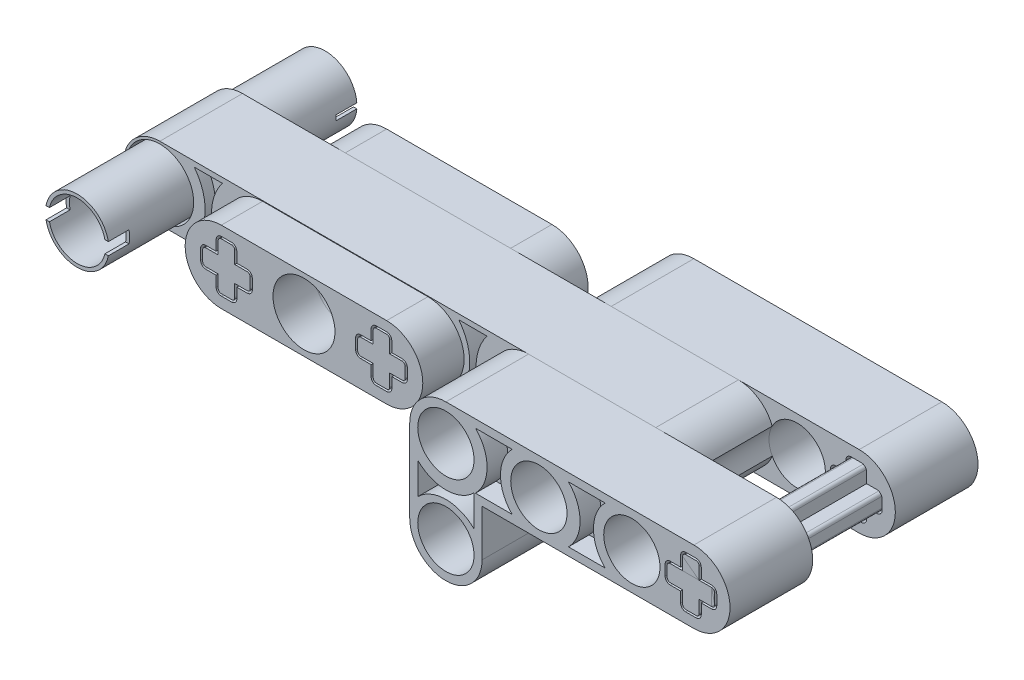
from build123d import *

# Parameters (mm, degrees)
BOSS_EXTRUDE2_DEPTH      = 8
CUT_EXTRUDE2_DEPTH       = 1
BOSS_EXTRUDE3_DEPTH      = 4
CUT_EXTRUDE3_START       = -1
CUT_EXTRUDE3_DEPTH       = 1
BOSS_EXTRUDE5_DEPTH      = 4
CUT_EXTRUDE6_DEPTH       = 33.014120225
SKETCH13_R               = 3.275
SKETCH13_R_2             = 3.075
CUT_EXTRUDE8_DEPTH       = 31.214299492
CUT_EXTRUDE9_DEPTH       = 33.014120225
SKETCH20_R               = 3
CUT_EXTRUDE10_DEPTH      = 33.014120225
BOSS_EXTRUDE6_DEPTH      = 8
BOSS_EXTRUDE6_DEPTH_BACK = 16
SKETCH21_R               = 3.075
SKETCH21_R_2             = 2.75
SKETCH22_W               = 6.441954092
SKETCH22_H               = 1.18479006
CUT_EXTRUDE11_DEPTH      = 2
SKETCH23_W               = 6.530888148
SKETCH23_H               = 0.5
CUT_EXTRUDE12_DEPTH      = 2
SKETCH24_R               = 2.75
CUT_EXTRUDE13_DEPTH      = 33.014120225
CUT_EXTRUDE14_DEPTH      = 2
BOSS_EXTRUDE8_DEPTH      = 8
BOSS_EXTRUDE10_DEPTH     = 8
CUT_EXTRUDE19_DEPTH      = 48.36948422
BOSS_EXTRUDE11_DEPTH     = 24
SKETCH42_R               = 2.725195378
CUT_EXTRUDE20_DEPTH      = 48.36948422
CUT_EXTRUDE21_DEPTH      = 2
CUT_EXTRUDE22_DEPTH      = 2
CUT_EXTRUDE23_DEPTH      = 2
CUT_EXTRUDE24_DEPTH      = 2
CUT_EXTRUDE25_DEPTH      = 2


with BuildPart() as part:
    # Sketch3 → Boss-Extrude2 (new body)
    with BuildSketch(Plane.XY):
        with BuildLine():
            Line((-24, 3.5), (24, 3.5))
            ThreePointArc((24, 3.5), (27.5, 0), (24, -3.5))
            Line((24, -3.5), (-24, -3.5))
            ThreePointArc((-24, -3.5), (-27.5, 0), (-24, 3.5))
        make_face()
    extrude(amount=BOSS_EXTRUDE2_DEPTH)

    # Sketch4 → Cut-Extrude2 (cut)
    with BuildSketch(Plane.XY.offset(8)):
        with BuildLine():
            Line((-20.670991697, 3), (-17.94298132, 3))
            ThreePointArc((-17.94298132, 3), (-19, -0.057231195), (-17.94298132, -3.114462389))
            Line((-17.94298132, -3.114462389), (-20.670991697, -3.114462389))
            ThreePointArc((-20.670991697, -3.114462389), (-19.613973017, -0.057231195), (-20.670991697, 3))
        make_face()
    extrude(amount=-CUT_EXTRUDE2_DEPTH, mode=Mode.SUBTRACT)

    # Sketch7 → Cut-Extrude3 (cut)
    with BuildSketch(Plane(origin=(0, 0, 0), x_dir=(-1, 0, 0), z_dir=(0, 0, -1)).offset(CUT_EXTRUDE3_START)):
        with BuildLine():
            Line((17.94298132, 3), (20.670991697, 3))
            ThreePointArc((20.670991697, 3), (19.613973017, -0.057231195), (20.670991697, -3.114462389))
            Line((20.670991697, -3.114462389), (17.94298132, -3.114462389))
            ThreePointArc((17.94298132, -3.114462389), (19, -0.057231195), (17.94298132, 3))
        make_face()
    extrude(amount=CUT_EXTRUDE3_DEPTH, mode=Mode.SUBTRACT)


with BuildPart() as body_2:
    # Sketch5 → Boss-Extrude3 (new body)
    with BuildSketch(Plane.XY.offset(8)):
        with BuildLine():
            Line((-14.050252532, 3.442768805), (1.949747468, 3.442768805))
            ThreePointArc((1.949747468, 3.442768805), (5.449747468, -0.057231195), (1.949747468, -3.557231195))
            Line((1.949747468, -3.557231195), (-14.050252532, -3.557231195))
            ThreePointArc((-14.050252532, -3.557231195), (-17.550252532, -0.057231195), (-14.050252532, 3.442768805))
        make_face()
    extrude(amount=BOSS_EXTRUDE3_DEPTH)


with BuildPart() as body_3:
    # Sketch10 → Boss-Extrude5 (new body)
    with BuildSketch(Plane(origin=(0, 0, 0), x_dir=(-1, 0, 0), z_dir=(0, 0, -1))):
        with BuildLine():
            Line((-1.95, 3.5), (14.05, 3.5))
            ThreePointArc((14.05, 3.5), (17.55, 0), (14.05, -3.5))
            Line((14.05, -3.5), (-1.95, -3.5))
            ThreePointArc((-1.95, -3.5), (-5.45, 0), (-1.95, 3.5))
        make_face()
    extrude(amount=BOSS_EXTRUDE5_DEPTH)


with BuildPart() as cut_extrude6_tool:
    # Sketch12 → Cut-Extrude6 (new, through all)
    # profile 1 of 2: a face of its own
    with BuildSketch(Plane(origin=(0, 0, -4), x_dir=(-1, 0, 0), z_dir=(0, 0, -1))):
        with BuildLine():
            Line((-2.45, -1), (-2.45, -2))
            ThreePointArc((-2.45, -2), (-2.303553391, -2.353553391), (-1.95, -2.5))
            Line((-1.95, -2.5), (-0.95, -2.5))
            ThreePointArc((-0.95, -2.5), (-0.596446609, -2.353553391), (-0.45, -2))
            Line((-0.45, -2), (-0.45, -1))
            Line((-0.45, -1), (0.55, -1))
            ThreePointArc((0.55, -1), (0.903553391, -0.853553391), (1.05, -0.5))
            Line((1.05, -0.5), (1.05, 0.5))
            ThreePointArc((1.05, 0.5), (0.903553391, 0.853553391), (0.55, 1))
            Line((0.55, 1), (-0.45, 1))
            Line((-0.45, 1), (-0.45, 2))
            ThreePointArc((-0.45, 2), (-0.596446609, 2.353553391), (-0.95, 2.5))
            Line((-0.95, 2.5), (-1.95, 2.5))
            ThreePointArc((-1.95, 2.5), (-2.303553391, 2.353553391), (-2.45, 2))
            Line((-2.45, 2), (-2.45, 1))
            Line((-2.45, 1), (-3.45, 1))
            ThreePointArc((-3.45, 1), (-3.803553391, 0.853553391), (-3.95, 0.5))
            Line((-3.95, 0.5), (-3.95, -0.5))
            ThreePointArc((-3.95, -0.5), (-3.803553391, -0.853553391), (-3.45, -1))
            Line((-3.45, -1), (-2.45, -1))
        make_face()
        with BuildLine():
            Line((-0.65, 2), (-0.65, 0.8))
            Line((-0.65, 0.8), (0.55, 0.8))
            ThreePointArc((0.55, 0.8), (0.762132034, 0.712132034), (0.85, 0.5))
            Line((0.85, 0.5), (0.85, -0.5))
            ThreePointArc((0.85, -0.5), (0.762132034, -0.712132034), (0.55, -0.8))
            Line((0.55, -0.8), (-0.65, -0.8))
            Line((-0.65, -0.8), (-0.65, -2))
            ThreePointArc((-0.65, -2), (-0.737867966, -2.212132034), (-0.95, -2.3))
            Line((-0.95, -2.3), (-1.95, -2.3))
            ThreePointArc((-1.95, -2.3), (-2.162132034, -2.212132034), (-2.25, -2))
            Line((-2.25, -2), (-2.25, -0.8))
            Line((-2.25, -0.8), (-3.45, -0.8))
            ThreePointArc((-3.45, -0.8), (-3.662132034, -0.712132034), (-3.75, -0.5))
            Line((-3.75, -0.5), (-3.75, 0.5))
            ThreePointArc((-3.75, 0.5), (-3.662132034, 0.712132034), (-3.45, 0.8))
            Line((-3.45, 0.8), (-2.25, 0.8))
            Line((-2.25, 0.8), (-2.25, 2))
            ThreePointArc((-2.25, 2), (-2.162132034, 2.212132034), (-1.95, 2.3))
            Line((-1.95, 2.3), (-0.95, 2.3))
            ThreePointArc((-0.95, 2.3), (-0.737867966, 2.212132034), (-0.65, 2))
        make_face(mode=Mode.SUBTRACT)
    # profile 2 of 2: a face of its own
    with BuildSketch(Plane(origin=(0, 0, -4), x_dir=(-1, 0, 0), z_dir=(0, 0, -1))):
        with BuildLine():
            Line((12.550877337, -1.005249858), (12.550877337, -2.005249858))
            ThreePointArc((12.550877337, -2.005249858), (12.697401286, -2.358771203), (13.050986705, -2.505140466))
            Line((13.050986705, -2.505140466), (14.050986705, -2.505140466))
            ThreePointArc((14.050986705, -2.505140466), (14.404524075, -2.358655186), (14.550932012, -2.005085779))
            Line((14.550932012, -2.005085779), (14.550932012, -1.005085779))
            Line((14.550932012, -1.005085779), (15.550932012, -1.005085779))
            ThreePointArc((15.550932012, -1.005085779), (15.90366182, -0.858531967), (16.05, -0.505712646))
            Line((16.05, -0.505712646), (16.05, 0.494287354))
            ThreePointArc((16.05, 0.494287354), (15.90355691, 0.847839714), (15.550007465, 0.994289843))
            Line((15.550007465, 0.994289843), (14.550007465, 0.994289843))
            Line((14.550007465, 0.994289843), (14.550007465, 1.994289843))
            ThreePointArc((14.550007465, 1.994289843), (14.405592491, 2.351542997), (14.05, 2.5))
            Line((14.05, 2.5), (13.05, 2.5))
            ThreePointArc((13.05, 2.5), (12.694011255, 2.352012474), (12.549127257, 1.994749376))
            Line((12.549127257, 1.994749376), (12.549127257, 0.994749376))
            Line((12.549127257, 0.994749376), (11.549127257, 0.994749376))
            ThreePointArc((11.549127257, 0.994749376), (11.195983475, 0.847839978), (11.05, 0.494312431))
            Line((11.05, 0.494312431), (11.05, -0.505687569))
            ThreePointArc((11.05, -0.505687569), (11.196911459, -0.859268448), (11.550877337, -1.005249858))
            Line((11.550877337, -1.005249858), (12.550877337, -1.005249858))
        make_face()
        with BuildLine():
            Line((14.350007465, 1.994289843), (14.350007465, 0.794289843))
            Line((14.350007465, 0.794289843), (15.550007465, 0.794289843))
            ThreePointArc((15.550007465, 0.794289843), (15.762139499, 0.706421877), (15.850007465, 0.494289843))
            Line((15.850007465, 0.494289843), (15.850007465, -0.505710157))
            ThreePointArc((15.850007465, -0.505710157), (15.762139499, -0.717842192), (15.550007465, -0.805710157))
            Line((15.550007465, -0.805710157), (14.350007465, -0.805710157))
            Line((14.350007465, -0.805710157), (14.350007465, -2.005710157))
            ThreePointArc((14.350007465, -2.005710157), (14.262139499, -2.217842192), (14.050007465, -2.305710157))
            Line((14.050007465, -2.305710157), (13.050007465, -2.305710157))
            ThreePointArc((13.050007465, -2.305710157), (12.83787543, -2.217842192), (12.750007465, -2.005710157))
            Line((12.750007465, -2.005710157), (12.750007465, -0.805710157))
            Line((12.750007465, -0.805710157), (11.550007465, -0.805710157))
            ThreePointArc((11.550007465, -0.805710157), (11.33787543, -0.717842192), (11.250007465, -0.505710157))
            Line((11.250007465, -0.505710157), (11.250007465, 0.494289843))
            ThreePointArc((11.250007465, 0.494289843), (11.33787543, 0.706421877), (11.550007465, 0.794289843))
            Line((11.550007465, 0.794289843), (12.750007465, 0.794289843))
            Line((12.750007465, 0.794289843), (12.750007465, 1.994289843))
            ThreePointArc((12.750007465, 1.994289843), (12.83787543, 2.206421877), (13.050007465, 2.294289843))
            Line((13.050007465, 2.294289843), (14.050007465, 2.294289843))
            ThreePointArc((14.050007465, 2.294289843), (14.262139499, 2.206421877), (14.350007465, 1.994289843))
        make_face(mode=Mode.SUBTRACT)
    extrude(amount=-CUT_EXTRUDE6_DEPTH)


with BuildPart() as body_2_1:
    add(body_2.part)

    # Cut-Extrude6: cut by cut_extrude6_tool
    add(cut_extrude6_tool.part, mode=Mode.SUBTRACT)


with BuildPart() as part_1:
    add(part.part)

    # Cut-Extrude6: cut by cut_extrude6_tool
    add(cut_extrude6_tool.part, mode=Mode.SUBTRACT)


with BuildPart() as cut_extrude6_piece_1:
    # of the separate pieces the step leaves, piece 1, a body of its own (cut_extrude6_pieces)
    add(part_1.part.solids().sort_by_distance((-24, 3.5, 0))[0])

    # Sketch13 → Cut-Extrude8 (cut, through all)
    with BuildSketch(Plane.XY.offset(8)):
        with Locations((-24, 0)):
            Circle(SKETCH13_R)
        with Locations((-24, 0)):
            Circle(SKETCH13_R_2, mode=Mode.SUBTRACT)
    extrude(amount=-CUT_EXTRUDE8_DEPTH, mode=Mode.SUBTRACT)


with BuildPart() as cut_extrude6_piece_2:
    # of the separate pieces the step leaves, piece 2, a body of its own (cut_extrude6_pieces)
    add(part_1.part.solids().sort_by_distance((1.95, 2.3, 0))[0])


with BuildPart() as cut_extrude6_piece_3:
    # of the separate pieces the step leaves, piece 3, a body of its own (cut_extrude6_pieces)
    add(part_1.part.solids().sort_by_distance((-14.350007465, 1.994289843, 0))[0])


with BuildPart() as cut_extrude6_piece_1_of_body_2:
    # of the separate pieces the step leaves, piece 1, a body of its own (cut_extrude6_pieces_of_body_2)
    add(body_2_1.part.solids().sort_by_distance((1.949747468, -3.557231195, 8))[0])


with BuildPart() as cut_extrude6_piece_2_of_body_2:
    # of the separate pieces the step leaves, piece 2, a body of its own (cut_extrude6_pieces_of_body_2)
    add(body_2_1.part.solids().sort_by_distance((1.95, 2.3, 8))[0])


with BuildPart() as cut_extrude6_piece_3_of_body_2:
    # of the separate pieces the step leaves, piece 3, a body of its own (cut_extrude6_pieces_of_body_2)
    add(body_2_1.part.solids().sort_by_distance((-14.350007465, 1.994289843, 8))[0])


with BuildPart() as cut_extrude8_piece_1:
    # of the separate pieces the step leaves, piece 1, a body of its own (cut_extrude8_pieces)
    add(cut_extrude6_piece_1.part.solids().sort_by_distance((-24, 3.5, 0))[0])


with BuildPart() as cut_extrude8_piece_2:
    # of the separate pieces the step leaves, piece 2, a body of its own (cut_extrude8_pieces)
    add(cut_extrude6_piece_1.part.solids().sort_by_distance((-20.925, 0, 0))[0])

    # Sketch21 → Boss-Extrude6 (add, two sides: drawn at the far end of the back side and taken through both)
    with BuildSketch(Plane.XY.offset(8).offset(-BOSS_EXTRUDE6_DEPTH_BACK)):
        with Locations((-24, 0)):
            Circle(SKETCH21_R)
        with Locations((-24, 0)):
            Circle(SKETCH21_R_2, mode=Mode.SUBTRACT)
    extrude(amount=BOSS_EXTRUDE6_DEPTH + BOSS_EXTRUDE6_DEPTH_BACK)

    # Sketch22 → Cut-Extrude11 (cut)
    with BuildSketch(Plane.XY.offset(16)):
        with Locations((-24, 0)):
            Rectangle(SKETCH22_W, SKETCH22_H)
    extrude(amount=-CUT_EXTRUDE11_DEPTH, mode=Mode.SUBTRACT)

    # Sketch23 → Cut-Extrude12 (cut)
    with BuildSketch(Plane(origin=(0, 0, -8), x_dir=(-1, 0, 0), z_dir=(0, 0, -1))):
        with Locations((24, 0)):
            Rectangle(SKETCH23_W, SKETCH23_H)
    extrude(amount=-CUT_EXTRUDE12_DEPTH, mode=Mode.SUBTRACT)

    # Sketch24 → Cut-Extrude13 (cut, through all)
    with BuildSketch(Plane.XY.offset(8)):
        with Locations((-24, 0)):
            Circle(SKETCH24_R)
    extrude(amount=-CUT_EXTRUDE13_DEPTH, mode=Mode.SUBTRACT)


with BuildPart() as cut_extrude9_tool:
    # Sketch17 → Cut-Extrude9 (new, through all)
    # profile 1 of 2: a face of its own
    with BuildSketch(Plane(origin=(0, 0, -4), x_dir=(-1, 0, 0), z_dir=(0, 0, -1))):
        with BuildLine():
            Line((-2.453895743, -1), (-2.453895743, -2))
            ThreePointArc((-2.453895743, -2), (-2.307449133, -2.353553391), (-1.953895743, -2.5))
            Line((-1.953895743, -2.5), (-0.953895743, -2.5))
            ThreePointArc((-0.953895743, -2.5), (-0.600342352, -2.353553391), (-0.453895743, -2))
            Line((-0.453895743, -2), (-0.453895743, -1))
            Line((-0.453895743, -1), (0.546104257, -1))
            ThreePointArc((0.546104257, -1), (0.899657648, -0.853553391), (1.046104257, -0.5))
            Line((1.046104257, -0.5), (1.046104257, 0.5))
            ThreePointArc((1.046104257, 0.5), (0.899657648, 0.853553391), (0.546104257, 1))
            Line((0.546104257, 1), (-0.453895743, 1))
            Line((-0.453895743, 1), (-0.453895743, 2))
            ThreePointArc((-0.453895743, 2), (-0.600342352, 2.353553391), (-0.953895743, 2.5))
            Line((-0.953895743, 2.5), (-1.953895743, 2.5))
            ThreePointArc((-1.953895743, 2.5), (-2.307449133, 2.353553391), (-2.453895743, 2))
            Line((-2.453895743, 2), (-2.453895743, 1))
            Line((-2.453895743, 1), (-3.453895743, 1))
            ThreePointArc((-3.453895743, 1), (-3.807449133, 0.853553391), (-3.953895743, 0.5))
            Line((-3.953895743, 0.5), (-3.953895743, -0.5))
            ThreePointArc((-3.953895743, -0.5), (-3.807449133, -0.853553391), (-3.453895743, -1))
            Line((-3.453895743, -1), (-2.453895743, -1))
        make_face()
        with BuildLine():
            Line((-0.653895743, 2), (-0.653895743, 0.8))
            Line((-0.653895743, 0.8), (0.546104257, 0.8))
            ThreePointArc((0.546104257, 0.8), (0.758236292, 0.712132034), (0.846104257, 0.5))
            Line((0.846104257, 0.5), (0.846104257, -0.5))
            ThreePointArc((0.846104257, -0.5), (0.758236292, -0.712132034), (0.546104257, -0.8))
            Line((0.546104257, -0.8), (-0.653895743, -0.8))
            Line((-0.653895743, -0.8), (-0.653895743, -2))
            ThreePointArc((-0.653895743, -2), (-0.741763708, -2.212132034), (-0.953895743, -2.3))
            Line((-0.953895743, -2.3), (-1.953895743, -2.3))
            ThreePointArc((-1.953895743, -2.3), (-2.166027777, -2.212132034), (-2.253895743, -2))
            Line((-2.253895743, -2), (-2.253895743, -0.8))
            Line((-2.253895743, -0.8), (-3.453895743, -0.8))
            ThreePointArc((-3.453895743, -0.8), (-3.666027777, -0.712132034), (-3.753895743, -0.5))
            Line((-3.753895743, -0.5), (-3.753895743, 0.5))
            ThreePointArc((-3.753895743, 0.5), (-3.666027777, 0.712132034), (-3.453895743, 0.8))
            Line((-3.453895743, 0.8), (-2.253895743, 0.8))
            Line((-2.253895743, 0.8), (-2.253895743, 2))
            ThreePointArc((-2.253895743, 2), (-2.166027777, 2.212132034), (-1.953895743, 2.3))
            Line((-1.953895743, 2.3), (-0.953895743, 2.3))
            ThreePointArc((-0.953895743, 2.3), (-0.741763708, 2.212132034), (-0.653895743, 2))
        make_face(mode=Mode.SUBTRACT)
    # profile 2 of 2: a face of its own
    with BuildSketch(Plane(origin=(0, 0, -4), x_dir=(-1, 0, 0), z_dir=(0, 0, -1))):
        with BuildLine():
            Line((12.55, -1), (12.55, -2))
            ThreePointArc((12.55, -2), (12.696446609, -2.353553391), (13.05, -2.5))
            Line((13.05, -2.5), (14.05, -2.5))
            ThreePointArc((14.05, -2.5), (14.403553391, -2.353553391), (14.55, -2))
            Line((14.55, -2), (14.55, -1))
            Line((14.55, -1), (15.55, -1))
            ThreePointArc((15.55, -1), (15.903553391, -0.853553391), (16.05, -0.5))
            Line((16.05, -0.5), (16.05, 0.5))
            ThreePointArc((16.05, 0.5), (15.903553391, 0.853553391), (15.55, 1))
            Line((15.55, 1), (14.55, 1))
            Line((14.55, 1), (14.55, 2))
            ThreePointArc((14.55, 2), (14.403553391, 2.353553391), (14.05, 2.5))
            Line((14.05, 2.5), (13.05, 2.5))
            ThreePointArc((13.05, 2.5), (12.696446609, 2.353553391), (12.55, 2))
            Line((12.55, 2), (12.55, 1))
            Line((12.55, 1), (11.55, 1))
            ThreePointArc((11.55, 1), (11.196446609, 0.853553391), (11.05, 0.5))
            Line((11.05, 0.5), (11.05, -0.5))
            ThreePointArc((11.05, -0.5), (11.196446609, -0.853553391), (11.55, -1))
            Line((11.55, -1), (12.55, -1))
        make_face()
        with BuildLine():
            Line((14.35, 2), (14.35, 0.8))
            Line((14.35, 0.8), (15.55, 0.8))
            ThreePointArc((15.55, 0.8), (15.762132034, 0.712132034), (15.85, 0.5))
            Line((15.85, 0.5), (15.85, -0.5))
            ThreePointArc((15.85, -0.5), (15.762132034, -0.712132034), (15.55, -0.8))
            Line((15.55, -0.8), (14.35, -0.8))
            Line((14.35, -0.8), (14.35, -2))
            ThreePointArc((14.35, -2), (14.262132034, -2.212132034), (14.05, -2.3))
            Line((14.05, -2.3), (13.05, -2.3))
            ThreePointArc((13.05, -2.3), (12.837867966, -2.212132034), (12.75, -2))
            Line((12.75, -2), (12.75, -0.8))
            Line((12.75, -0.8), (11.55, -0.8))
            ThreePointArc((11.55, -0.8), (11.337867966, -0.712132034), (11.25, -0.5))
            Line((11.25, -0.5), (11.25, 0.5))
            ThreePointArc((11.25, 0.5), (11.337867966, 0.712132034), (11.55, 0.8))
            Line((11.55, 0.8), (12.75, 0.8))
            Line((12.75, 0.8), (12.75, 2))
            ThreePointArc((12.75, 2), (12.837867966, 2.212132034), (13.05, 2.3))
            Line((13.05, 2.3), (14.05, 2.3))
            ThreePointArc((14.05, 2.3), (14.262132034, 2.212132034), (14.35, 2))
        make_face(mode=Mode.SUBTRACT)
    extrude(amount=-CUT_EXTRUDE9_DEPTH)


with BuildPart() as body_3_1:
    add(body_3.part)

    # Cut-Extrude9: cut by cut_extrude9_tool
    add(cut_extrude9_tool.part, mode=Mode.SUBTRACT)


with BuildPart() as cut_extrude6_piece_2_1:
    add(cut_extrude6_piece_2.part)

    # Cut-Extrude9: cut by cut_extrude9_tool
    add(cut_extrude9_tool.part, mode=Mode.SUBTRACT)


with BuildPart() as cut_extrude6_piece_3_1:
    add(cut_extrude6_piece_3.part)

    # Cut-Extrude9: cut by cut_extrude9_tool
    add(cut_extrude9_tool.part, mode=Mode.SUBTRACT)


with BuildPart() as cut_extrude6_piece_1_of_body_2_1:
    add(cut_extrude6_piece_1_of_body_2.part)

    # Cut-Extrude9: cut by cut_extrude9_tool
    add(cut_extrude9_tool.part, mode=Mode.SUBTRACT)


with BuildPart() as cut_extrude6_piece_2_of_body_2_1:
    add(cut_extrude6_piece_2_of_body_2.part)

    # Cut-Extrude9: cut by cut_extrude9_tool
    add(cut_extrude9_tool.part, mode=Mode.SUBTRACT)


with BuildPart() as cut_extrude6_piece_3_of_body_2_1:
    add(cut_extrude6_piece_3_of_body_2.part)

    # Cut-Extrude9: cut by cut_extrude9_tool
    add(cut_extrude9_tool.part, mode=Mode.SUBTRACT)


with BuildPart() as cut_extrude8_piece_1_1:
    add(cut_extrude8_piece_1.part)

    # Cut-Extrude9: cut by cut_extrude9_tool
    add(cut_extrude9_tool.part, mode=Mode.SUBTRACT)


with BuildPart() as cut_extrude10_tool:
    # Sketch20 → Cut-Extrude10 (new, through all)
    with BuildSketch(Plane(origin=(0, 0, -4), x_dir=(-1, 0, 0), z_dir=(0, 0, -1))):
        with Locations((6.05, 0)):
            Circle(SKETCH20_R)
    extrude(amount=-CUT_EXTRUDE10_DEPTH)


with BuildPart() as body_3_2:
    add(body_3_1.part)

    # Cut-Extrude10: cut by cut_extrude10_tool
    add(cut_extrude10_tool.part, mode=Mode.SUBTRACT)


with BuildPart() as cut_extrude6_piece_1_of_body_2_2:
    add(cut_extrude6_piece_1_of_body_2_1.part)

    # Cut-Extrude10: cut by cut_extrude10_tool
    add(cut_extrude10_tool.part, mode=Mode.SUBTRACT)


with BuildPart() as cut_extrude8_piece_1_2:
    add(cut_extrude8_piece_1_1.part)

    # Cut-Extrude10: cut by cut_extrude10_tool
    add(cut_extrude10_tool.part, mode=Mode.SUBTRACT)

    # Sketch26 → Cut-Extrude14 (cut)
    with BuildSketch(Plane.XY.offset(8)):
        with BuildLine():
            Line((4.94298132, 3), (7.670991697, 3))
            ThreePointArc((7.670991697, 3), (6.613973017, -0.057231195), (7.670991697, -3.114462389))
            Line((7.670991697, -3.114462389), (4.94298132, -3.114462389))
            ThreePointArc((4.94298132, -3.114462389), (6, -0.057231195), (4.94298132, 3))
        make_face()
    extrude(amount=-CUT_EXTRUDE14_DEPTH, mode=Mode.SUBTRACT)


with BuildPart() as body_9:
    # Sketch29 → Boss-Extrude8 (new body)
    with BuildSketch(Plane.XY.offset(8)):
        with BuildLine():
            ThreePointArc((11.68696281, 3.5), (9.212088919, 2.47487382), (8.186962567, 0))
            Line((8.186962567, 0), (8.186962567, -8.00000024))
            ThreePointArc((8.186962567, -8.00000024), (11.686962808, -11.5), (15.186962567, -7.99999976))
            Line((15.186962567, -7.99999976), (15.186962567, -3.5))
            Line((15.186962567, -3.5), (35.686962567, -3.5))
            ThreePointArc((35.686962567, -3.5), (39.186962567, 0), (35.686962567, 3.5))
            Line((35.686962567, 3.5), (11.68696281, 3.5))
        make_face()
    extrude(amount=BOSS_EXTRUDE8_DEPTH)


with BuildPart() as body_10:
    # Sketch36 → Boss-Extrude10 (new body)
    with BuildSketch(Plane(origin=(0, 0, 0), x_dir=(-1, 0, 0), z_dir=(0, 0, -1))):
        with BuildLine():
            Line((-35.686962567, 3.5), (-11.686962567, 3.5))
            ThreePointArc((-11.686962567, 3.5), (-9.212088833, 2.474873734), (-8.186962567, 0))
            Line((-8.186962567, 0), (-8.186962567, -8))
            ThreePointArc((-8.186962567, -8), (-11.686962687, -11.49999976), (-15.186962567, -7.99999976))
            Line((-15.186962567, -7.99999976), (-15.186962567, -3.5))
            Line((-15.186962567, -3.5), (-35.686962567, -3.5))
            ThreePointArc((-35.686962567, -3.5), (-39.186962567, 0), (-35.686962567, 3.5))
        make_face()
    extrude(amount=BOSS_EXTRUDE10_DEPTH)


with BuildPart() as cut_extrude19_tool:
    # Sketch40 → Cut-Extrude19 (new, through all)
    with BuildSketch(Plane(origin=(0, 0, -8), x_dir=(-1, 0, 0), z_dir=(0, 0, -1))):
        with BuildLine():
            Line((-36.402453008, -1), (-36.402453008, -2))
            ThreePointArc((-36.402453008, -2), (-36.256006399, -2.353553391), (-35.902453008, -2.5))
            Line((-35.902453008, -2.5), (-34.902453008, -2.5))
            ThreePointArc((-34.902453008, -2.5), (-34.548899618, -2.353553391), (-34.402453008, -2))
            Line((-34.402453008, -2), (-34.402453008, -1))
            Line((-34.402453008, -1), (-33.402453008, -1))
            ThreePointArc((-33.402453008, -1), (-33.048899618, -0.853553391), (-32.902453008, -0.5))
            Line((-32.902453008, -0.5), (-32.902453008, 0.5))
            ThreePointArc((-32.902453008, 0.5), (-33.048899618, 0.853553391), (-33.402453008, 1))
            Line((-33.402453008, 1), (-34.402453008, 1))
            Line((-34.402453008, 1), (-34.402453008, 2))
            ThreePointArc((-34.402453008, 2), (-34.548899618, 2.353553391), (-34.902453008, 2.5))
            Line((-34.902453008, 2.5), (-35.902453008, 2.5))
            ThreePointArc((-35.902453008, 2.5), (-36.256006399, 2.353553391), (-36.402453008, 2))
            Line((-36.402453008, 2), (-36.402453008, 1))
            Line((-36.402453008, 1), (-37.402453008, 1))
            ThreePointArc((-37.402453008, 1), (-37.756006399, 0.853553391), (-37.902453008, 0.5))
            Line((-37.902453008, 0.5), (-37.902453008, -0.5))
            ThreePointArc((-37.902453008, -0.5), (-37.756006399, -0.853553391), (-37.402453008, -1))
            Line((-37.402453008, -1), (-36.402453008, -1))
        make_face()
        with BuildLine():
            Line((-34.602453008, 2), (-34.602453008, 0.8))
            Line((-34.602453008, 0.8), (-33.402453008, 0.8))
            ThreePointArc((-33.402453008, 0.8), (-33.190320974, 0.712132034), (-33.102453008, 0.5))
            Line((-33.102453008, 0.5), (-33.102453008, -0.5))
            ThreePointArc((-33.102453008, -0.5), (-33.190320974, -0.712132034), (-33.402453008, -0.8))
            Line((-33.402453008, -0.8), (-34.602453008, -0.8))
            Line((-34.602453008, -0.8), (-34.602453008, -2))
            ThreePointArc((-34.602453008, -2), (-34.690320974, -2.212132034), (-34.902453008, -2.3))
            Line((-34.902453008, -2.3), (-35.902453008, -2.3))
            ThreePointArc((-35.902453008, -2.3), (-36.114585043, -2.212132034), (-36.202453008, -2))
            Line((-36.202453008, -2), (-36.202453008, -0.8))
            Line((-36.202453008, -0.8), (-37.402453008, -0.8))
            ThreePointArc((-37.402453008, -0.8), (-37.614585043, -0.712132034), (-37.702453008, -0.5))
            Line((-37.702453008, -0.5), (-37.702453008, 0.5))
            ThreePointArc((-37.702453008, 0.5), (-37.614585043, 0.712132034), (-37.402453008, 0.8))
            Line((-37.402453008, 0.8), (-36.202453008, 0.8))
            Line((-36.202453008, 0.8), (-36.202453008, 2))
            ThreePointArc((-36.202453008, 2), (-36.114585043, 2.212132034), (-35.902453008, 2.3))
            Line((-35.902453008, 2.3), (-34.902453008, 2.3))
            ThreePointArc((-34.902453008, 2.3), (-34.690320974, 2.212132034), (-34.602453008, 2))
        make_face(mode=Mode.SUBTRACT)
    extrude(amount=-CUT_EXTRUDE19_DEPTH)


with BuildPart() as body_9_1:
    add(body_9.part)

    # Cut-Extrude19: cut by cut_extrude19_tool
    add(cut_extrude19_tool.part, mode=Mode.SUBTRACT)


with BuildPart() as body_10_1:
    add(body_10.part)

    # Cut-Extrude19: cut by cut_extrude19_tool
    add(cut_extrude19_tool.part, mode=Mode.SUBTRACT)


with BuildPart() as cut_extrude19_piece_1:
    # of the separate pieces the step leaves, piece 1, a body of its own (cut_extrude19_pieces)
    add(body_9_1.part.solids().sort_by_distance((15.186962567, -7.99999976, 8))[0])


with BuildPart() as cut_extrude19_piece_2:
    # of the separate pieces the step leaves, piece 2, a body of its own (cut_extrude19_pieces)
    add(body_9_1.part.solids().sort_by_distance((34.902453008, 2.3, 8))[0])


with BuildPart() as cut_extrude19_piece_1_of_body_10:
    # of the separate pieces the step leaves, piece 1, a body of its own (cut_extrude19_pieces_of_body_10)
    add(body_10_1.part.solids().sort_by_distance((35.686962567, -3.5, 0))[0])


with BuildPart() as cut_extrude19_piece_2_of_body_10:
    # of the separate pieces the step leaves, piece 2, a body of its own (cut_extrude19_pieces_of_body_10)
    add(body_10_1.part.solids().sort_by_distance((34.902453008, 2.3, 0))[0])


with BuildPart() as body_13:
    # Sketch41 → Boss-Extrude11 (new body)
    with BuildSketch(Plane(origin=(0, 0, -8), x_dir=(-1, 0, 0), z_dir=(0, 0, -1))):
        with BuildLine():
            Line((-34.602453008, 2), (-34.602453008, 0.8))
            Line((-34.602453008, 0.8), (-33.402453008, 0.8))
            ThreePointArc((-33.402453008, 0.8), (-33.190320974, 0.712132034), (-33.102453008, 0.5))
            Line((-33.102453008, 0.5), (-33.102453008, -0.5))
            ThreePointArc((-33.102453008, -0.5), (-33.190320974, -0.712132034), (-33.402453008, -0.8))
            Line((-33.402453008, -0.8), (-34.602453008, -0.8))
            Line((-34.602453008, -0.8), (-34.602453008, -2))
            ThreePointArc((-34.602453008, -2), (-34.690320974, -2.212132034), (-34.902453008, -2.3))
            Line((-34.902453008, -2.3), (-35.902453008, -2.3))
            ThreePointArc((-35.902453008, -2.3), (-36.114585043, -2.212132034), (-36.202453008, -2))
            Line((-36.202453008, -2), (-36.202453008, -0.8))
            Line((-36.202453008, -0.8), (-37.402453008, -0.8))
            ThreePointArc((-37.402453008, -0.8), (-37.614585043, -0.712132034), (-37.702453008, -0.5))
            Line((-37.702453008, -0.5), (-37.702453008, 0.5))
            ThreePointArc((-37.702453008, 0.5), (-37.614585043, 0.712132034), (-37.402453008, 0.8))
            Line((-37.402453008, 0.8), (-36.202453008, 0.8))
            Line((-36.202453008, 0.8), (-36.202453008, 2))
            ThreePointArc((-36.202453008, 2), (-36.114585043, 2.212132034), (-35.902453008, 2.3))
            Line((-35.902453008, 2.3), (-34.902453008, 2.3))
            ThreePointArc((-34.902453008, 2.3), (-34.690320974, 2.212132034), (-34.602453008, 2))
        make_face()
    extrude(amount=-BOSS_EXTRUDE11_DEPTH)


with BuildPart() as cut_extrude20_tool:
    # Sketch42 → Cut-Extrude20 (new, through all)
    with BuildSketch(Plane(origin=(0, 0, -8), x_dir=(-1, 0, 0), z_dir=(0, 0, -1))):
        with Locations((-11.686962567, 0)):
            Circle(SKETCH42_R)
        with Locations((-20.686962567, 0)):
            Circle(SKETCH42_R)
        with Locations((-29.686962567, 0)):
            Circle(SKETCH42_R)
        with Locations((-11.686962567, -8)):
            Circle(SKETCH42_R)
    extrude(amount=-CUT_EXTRUDE20_DEPTH)


with BuildPart() as cut_extrude8_piece_1_3:
    add(cut_extrude8_piece_1_2.part)

    # Cut-Extrude20: cut by cut_extrude20_tool
    add(cut_extrude20_tool.part, mode=Mode.SUBTRACT)

    # Sketch48 → Cut-Extrude25 (cut)
    with BuildSketch(Plane(origin=(0, 0, 0), x_dir=(-1, 0, 0), z_dir=(0, 0, -1))):
        with BuildLine():
            Line((-7.93813649, 3.00101974), (-5.210126113, 3.00101974))
            ThreePointArc((-5.210126113, 3.00101974), (-6.267144793, -0.056211454), (-5.210126113, -3.113442649))
            Line((-5.210126113, -3.113442649), (-7.93813649, -3.113442649))
            ThreePointArc((-7.93813649, -3.113442649), (-6.88111781, -0.056211454), (-7.93813649, 3.00101974))
        make_face()
    extrude(amount=-CUT_EXTRUDE25_DEPTH, mode=Mode.SUBTRACT)


with BuildPart() as cut_extrude19_piece_1_1:
    add(cut_extrude19_piece_1.part)

    # Cut-Extrude20: cut by cut_extrude20_tool
    add(cut_extrude20_tool.part, mode=Mode.SUBTRACT)

    # Sketch44 → Cut-Extrude22 (cut)
    with BuildSketch(Plane.XY.offset(16)):
        with BuildLine():
            Line((14.546850456, 2.725195378), (18.096459699, 2.725195378))
            ThreePointArc((18.096459699, 2.725195378), (16.967646813, 0), (18.096459699, -2.725195378))
            Line((18.096459699, -2.725195378), (14.546850456, -2.725195378))
            ThreePointArc((14.546850456, -2.725195378), (15.675663342, 0), (14.546850456, 2.725195378))
        make_face()
        with BuildLine():
            Line((23.546850456, 2.725195378), (27.096459699, 2.725195378))
            ThreePointArc((27.096459699, 2.725195378), (25.967646813, 0), (27.096459699, -2.725195378))
            Line((27.096459699, -2.725195378), (23.546850456, -2.725195378))
            ThreePointArc((23.546850456, -2.725195378), (24.675663342, 0), (23.546850456, 2.725195378))
        make_face()
    extrude(amount=-CUT_EXTRUDE22_DEPTH, mode=Mode.SUBTRACT)

    # Sketch45 → Cut-Extrude23 (cut)
    with BuildSketch(Plane.XY.offset(16)):
        with BuildLine():
            Line((8.970994862, -2.758581871), (8.970994862, -5.80184064))
            ThreePointArc((8.970994862, -5.80184064), (11.694496176, -4.674720765), (14.417997491, -5.80184064))
            Line((14.417997491, -5.80184064), (14.417997491, -2.758581871))
            ThreePointArc((14.417997491, -2.758581871), (11.694496176, -3.885701746), (8.970994862, -2.758581871))
        make_face()
    extrude(amount=-CUT_EXTRUDE23_DEPTH, mode=Mode.SUBTRACT)


with BuildPart() as cut_extrude19_piece_1_of_body_10_1:
    add(cut_extrude19_piece_1_of_body_10.part)

    # Cut-Extrude20: cut by cut_extrude20_tool
    add(cut_extrude20_tool.part, mode=Mode.SUBTRACT)

    # Sketch43 → Cut-Extrude21 (cut)
    with BuildSketch(Plane(origin=(0, 0, -8), x_dir=(-1, 0, 0), z_dir=(0, 0, -1))):
        with BuildLine():
            Line((-26.961767189, 2.725195378), (-23.412157946, 2.725195378))
            ThreePointArc((-23.412157946, 2.725195378), (-24.540970832, 0), (-23.412157946, -2.725195378))
            Line((-23.412157946, -2.725195378), (-26.961767189, -2.725195378))
            ThreePointArc((-26.961767189, -2.725195378), (-25.832954303, 0), (-26.961767189, 2.725195378))
        make_face()
        with BuildLine():
            Line((-17.961767189, 2.725195378), (-14.412157946, 2.725195378))
            ThreePointArc((-14.412157946, 2.725195378), (-15.540970832, 0), (-14.412157946, -2.725195378))
            Line((-14.412157946, -2.725195378), (-17.961767189, -2.725195378))
            ThreePointArc((-17.961767189, -2.725195378), (-16.832954303, 0), (-17.961767189, 2.725195378))
        make_face()
    extrude(amount=-CUT_EXTRUDE21_DEPTH, mode=Mode.SUBTRACT)

    # Sketch46 → Cut-Extrude24 (cut)
    with BuildSketch(Plane(origin=(0, 0, -8), x_dir=(-1, 0, 0), z_dir=(0, 0, -1))):
        with BuildLine():
            Line((-14.412157946, -2.815063211), (-14.412157946, -5.858321979))
            ThreePointArc((-14.412157946, -5.858321979), (-11.688656631, -4.731202105), (-8.965155316, -5.858321979))
            Line((-8.965155316, -5.858321979), (-8.965155316, -2.815063211))
            ThreePointArc((-8.965155316, -2.815063211), (-11.688656631, -3.942183085), (-14.412157946, -2.815063211))
        make_face()
    extrude(amount=-CUT_EXTRUDE24_DEPTH, mode=Mode.SUBTRACT)


solid = Compound([cut_extrude8_piece_2.part, cut_extrude6_piece_2_1.part, cut_extrude6_piece_3_1.part, cut_extrude6_piece_2_of_body_2_1.part, cut_extrude6_piece_3_of_body_2_1.part, body_3_2.part, cut_extrude6_piece_1_of_body_2_2.part, cut_extrude19_piece_2.part, cut_extrude19_piece_2_of_body_10.part, body_13.part, cut_extrude8_piece_1_3.part, cut_extrude19_piece_1_1.part, cut_extrude19_piece_1_of_body_10_1.part])
